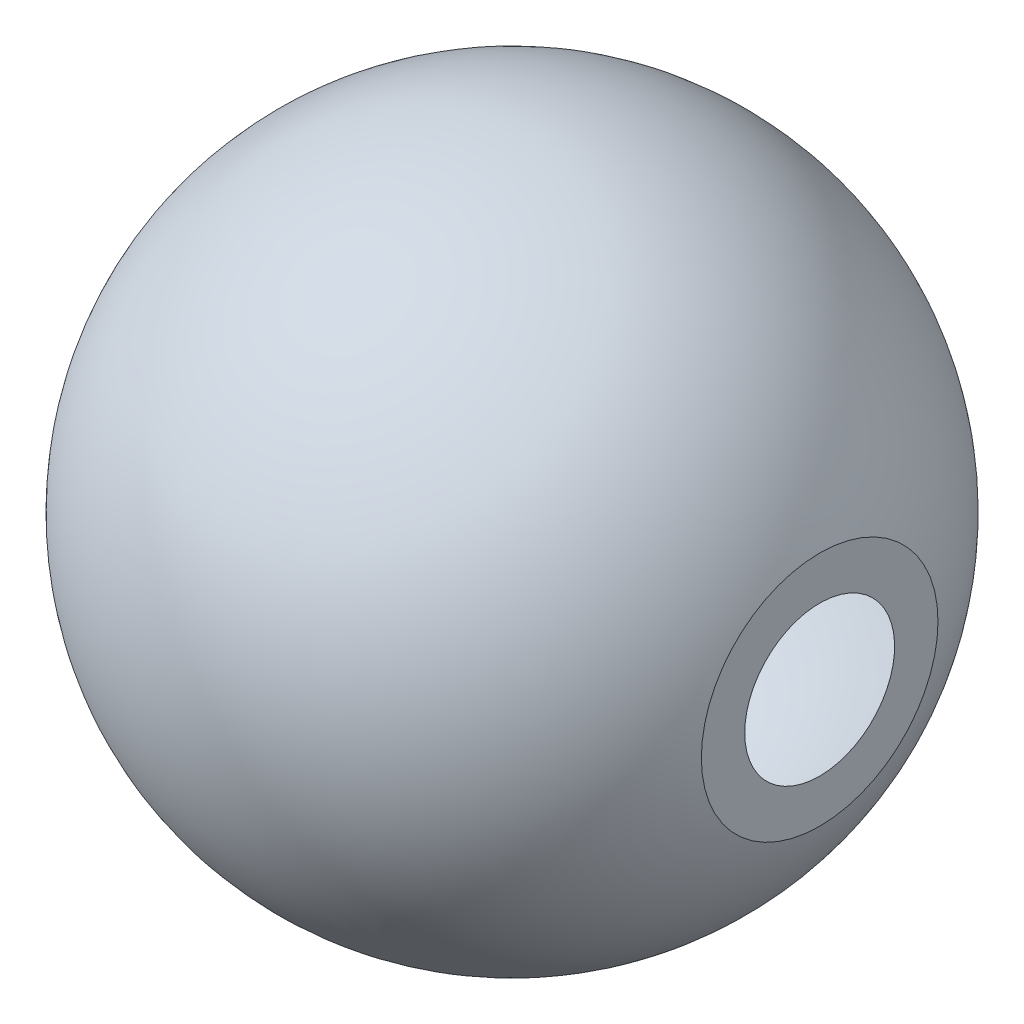
from build123d import *


with BuildPart() as part:
    # Sketch2 → Revolve1 (revolve)
    with BuildSketch(Plane.XY):
        with BuildLine():
            Line((-76.2, 0), (-73.2, 0))
            ThreePointArc((-73.2, 0), (-8.725136102, 72.678139767), (71.12, 17.325865058))
            Line((71.12, 17.325865058), (71.12, 27.356728124))
            add(Edge.make_bspline(
                [(-76.2, 0), (-76.199748736, 3.349875457), (-75.860503333, 9.142507883), (-74.549184229, 17.268418192), (-71.377783379, 27.39605801), (-67.350333811, 36.174910069), (-62.291980166, 44.321444262), (-56.253516569, 51.770929769), (-49.329921218, 58.405855002), (-41.63017181, 64.121878677), (-33.275398401, 68.829017982), (-24.397082242, 72.453215062), (-15.134914643, 74.93744234), (-5.638852494, 76.242037736), (3.941497706, 76.348246976), (13.455646882, 75.256193099), (22.754594075, 72.984779046), (31.696802832, 69.569110906), (40.142071884, 65.062776953), (47.957988362, 59.536349566), (55.022027399, 53.0766672), (61.223414555, 45.78457932), (66.064126989, 38.387933693), (68.964172753, 32.634345536), (70.525228655, 28.902824701), (71.12, 27.356728124)],
                knots=[0, 0, 0, 0, 0, 0.055862852, 0.096966234, 0.136917166, 0.176869463, 0.216822404, 0.25677525, 0.296728596, 0.336682013, 0.376635282, 0.4165885, 0.456541738, 0.496495014, 0.536377042, 0.576259031, 0.616141009, 0.656023042, 0.695905141, 0.73578707, 0.775668823, 0.815550716, 0.855432167, 0.883114119, 0.883114119, 0.883114119, 0.883114119, 0.883114119], degree=4))
        make_face()
    revolve(axis=Axis((-76.2, 0, 0), (1, 0, 0)))


solid = part.part
